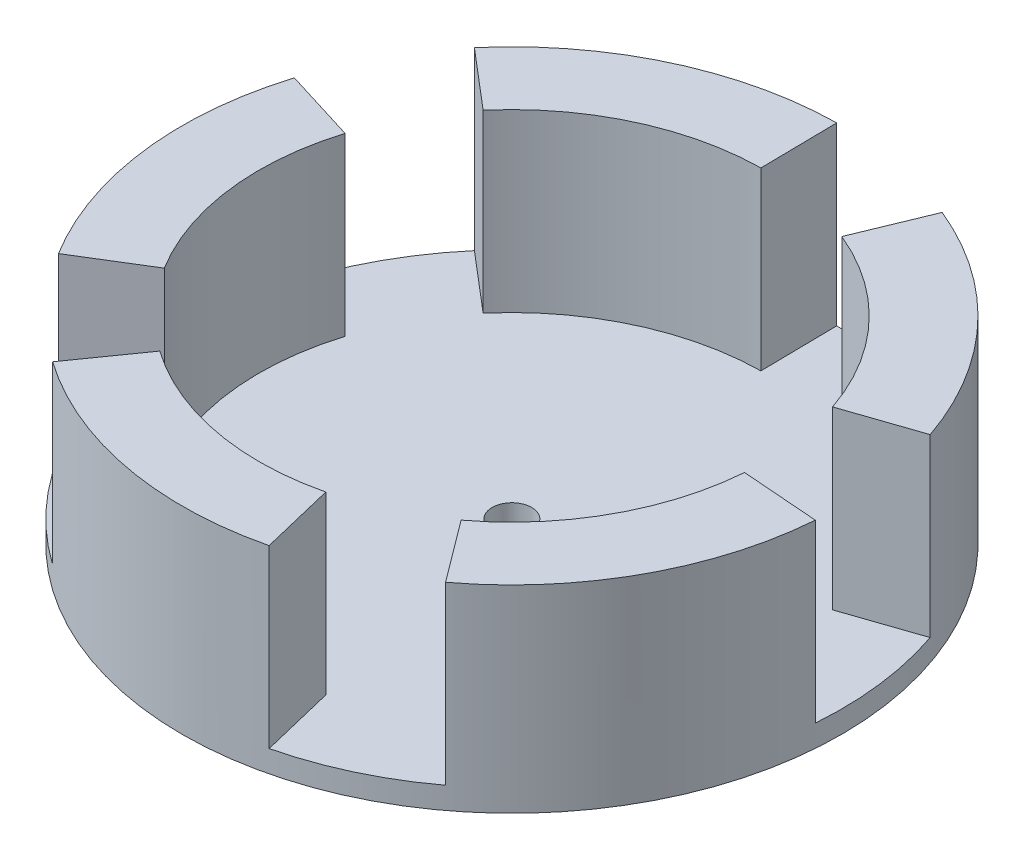
from build123d import *

# Parameters (mm, degrees)
SKETCH3_R           = 30
BOSS_EXTRUDE3_DEPTH = 2
BOSS_EXTRUDE4_DEPTH = 16
SKETCH5_R           = 8.5
BOSS_EXTRUDE5_DEPTH = 8
SKETCH6_R           = 1.8
CUT_EXTRUDE1_DEPTH  = 5
FILLET1_R           = 2


with BuildPart() as part:
    # Sketch3 → Boss-Extrude3 (new body)
    with BuildSketch(Plane(origin=(0, 0, 0), x_dir=(1, 0, 0), z_dir=(0, 1, 0))):
        Circle(SKETCH3_R)
    extrude(amount=BOSS_EXTRUDE3_DEPTH)

    # Sketch4 → Boss-Extrude4 (add)
    with BuildSketch(Plane(origin=(0, 2, 0), x_dir=(1, 0, 0), z_dir=(0, 1, 0))):
        with BuildLine():
            Line((13.78431234, -18.411755303), (17.979537834, -24.015333004))
            ThreePointArc((17.979537834, -24.015333004), (26.293545079, -14.444704468), (29.912119786, -2.294578373))
            Line((29.912119786, -2.294578373), (22.932625169, -1.759176753))
            ThreePointArc((22.932625169, -1.759176753), (20.158384561, -11.074273425), (13.78431234, -18.411755303))
        make_face()
        with BuildLine():
            Line((21.770206626, 7.420114788), (28.395921686, 9.678410593))
            ThreePointArc((28.395921686, 9.678410593), (21.862882582, 20.542988225), (11.425627065, 27.739052727))
            Line((11.425627065, 27.739052727), (8.759647417, 21.26660709))
            ThreePointArc((8.759647417, 21.26660709), (16.761543313, 15.749624306), (21.770206626, 7.420114788))
        make_face()
        with BuildLine():
            Line((-0.329584703, 22.997638442), (-0.42989309, 29.996919707))
            ThreePointArc((-0.42989309, 29.996919707), (-12.781540551, 27.140969421), (-22.850693917, 19.438255774))
            Line((-22.850693917, 19.438255774), (-17.518865336, 14.90266276))
            ThreePointArc((-17.518865336, 14.90266276), (-9.799181089, 20.808076556), (-0.329584703, 22.997638442))
        make_face()
        with BuildLine():
            Line((-21.973901174, 6.79320743), (-28.661610227, 8.860705343))
            ThreePointArc((-28.661610227, 8.860705343), (-29.762309071, -3.768946635), (-25.548132572, -15.725549976))
            Line((-25.548132572, -15.725549976), (-19.586901639, -12.056254982))
            ThreePointArc((-19.586901639, -12.056254982), (-22.817770288, -2.889525753), (-21.973901174, 6.79320743))
        make_face()
        with BuildLine():
            Line((-13.251033088, -18.799205358), (-17.283956202, -24.520702641))
            ThreePointArc((-17.283956202, -24.520702641), (-5.612578038, -29.470306543), (7.061079638, -29.157180151))
            Line((7.061079638, -29.157180151), (5.413494389, -22.353838116))
            ThreePointArc((5.413494389, -22.353838116), (-4.302976496, -22.593901683), (-13.251033088, -18.799205358))
        make_face()
    extrude(amount=BOSS_EXTRUDE4_DEPTH)

    # Sketch5 → Boss-Extrude5 (add)
    with BuildSketch(Plane.XZ):
        Circle(SKETCH5_R)
        Polygon((7.117575202, -0.77036133), (4.225940083, 5.778820273), (-2.891635119, 6.549181603), (-7.117575202, 0.77036133), (-4.225940083, -5.778820273), (2.891635119, -6.549181603), align=None, mode=Mode.SUBTRACT)
    extrude(amount=BOSS_EXTRUDE5_DEPTH)

    # Sketch6 → Cut-Extrude1 (cut)
    with BuildSketch(Plane.XZ):
        Circle(SKETCH6_R)
    extrude(amount=-CUT_EXTRUDE1_DEPTH, mode=Mode.SUBTRACT)

    # Fillet1
    fillet1_edges = [part.edges().sort_by_distance(p)[0] for p in [
        (-8.5, 0, 0),
    ]]
    fillet(fillet1_edges, radius=FILLET1_R)


solid = part.part
